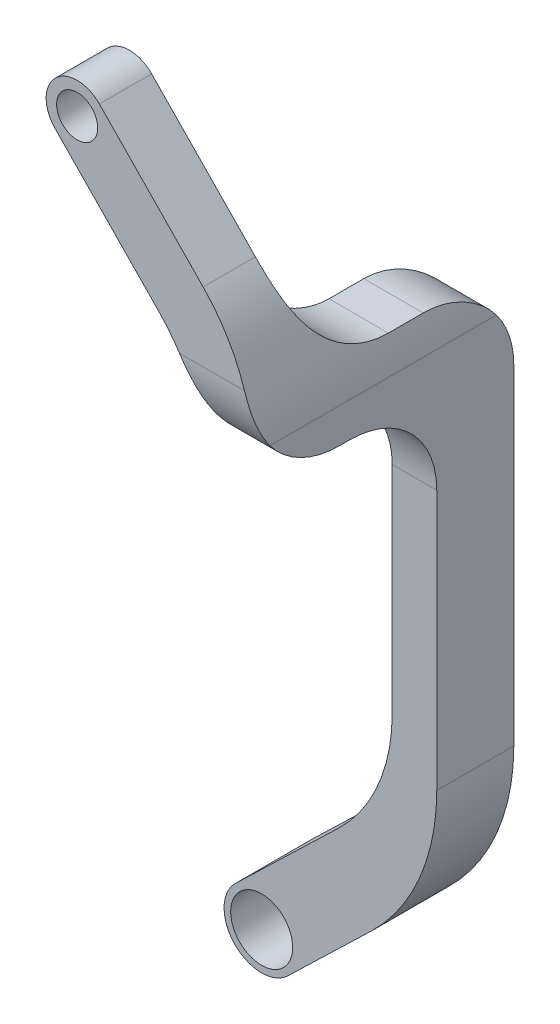
from build123d import *

# Parameters (mm, degrees)
SKETCH_1_R               = 11.8
SKETCH_1_R_2             = 17.8
EXTRUDE_2_DEPTH          = 75
CUT_EXTRUDE_1_DEPTH      = 409.99959193
CUT_EXTRUDE_1_DEPTH_BACK = 409.99959193
SKETCH_2_W               = 349.9
SKETCH_2_H               = 931.6
SKETCH_2_W_2             = 272.2
SKETCH_2_H_2             = 1939.2
FILLET_1_R               = 50


with BuildPart() as part:
    # 草图1 → 凸台-拉伸2 (new, symmetric)
    with BuildSketch(Plane.XY):
        with BuildLine():
            Line((-35.522730508, 95.251379062), (24.047591424, 34.058759041))
            ThreePointArc((24.047591424, 34.058759041), (45.036365139, 1.951247863), (52.39346962, -35.695716288))
            Line((52.39346962, -35.695716288), (52.39346962, -254.995716288))
            ThreePointArc((52.39346962, -254.995716288), (42.566387073, -303.252504348), (14.650341024, -343.823226775))
            Line((14.650341024, -343.823226775), (-33.168257533, -389.93401824))
            ThreePointArc((-33.168257533, -389.93401824), (-63.662585593, -389.379575912), (-63.108143264, -358.885247852))
            Line((-63.108143264, -358.885247852), (-3.792973322, -301.688476836))
            ThreePointArc((-3.792973322, -301.688476836), (18.829755143, -268.810595941), (26.79346962, -229.704047294))
            Line((26.79346962, -229.704047294), (26.79346962, -60.304047294))
            ThreePointArc((26.79346962, -60.304047294), (19.460018396, -22.778118982), (-1.461275938, 9.226165824))
            Line((-1.461275938, 9.226165824), (-61.03159787, 70.418785844))
            ThreePointArc((-61.03159787, 70.418785844), (-60.693460797, 95.589516134), (-35.522730508, 95.251379062))
        make_face()
        with Locations((-48.277164189, 82.835082453)):
            Circle(SKETCH_1_R, mode=Mode.SUBTRACT)
        with Locations((-48.138200399, -374.409633046)):
            Circle(SKETCH_1_R_2, mode=Mode.SUBTRACT)
    extrude(amount=EXTRUDE_2_DEPTH, both=True)

    # 草图2 → 切除-拉伸1 (cut, two sides: drawn at the far end of the back side and taken through both)
    with BuildSketch(Plane(origin=(0, 0, 0), x_dir=(0, 0, -1), z_dir=(1, 0, 0)).offset(-CUT_EXTRUDE_1_DEPTH_BACK)):
        with Locations((129.95, 450.104283712)):
            Rectangle(SKETCH_2_W, SKETCH_2_H)
        with Locations((-105.32326979, -1025.295716288)):
            Rectangle(SKETCH_2_W_2, SKETCH_2_H_2)
    extrude(amount=CUT_EXTRUDE_1_DEPTH + CUT_EXTRUDE_1_DEPTH_BACK, mode=Mode.SUBTRACT)

    # 圆角1
    fillet_1_edges = [part.edges().sort_by_distance(p)[0] for p in [
        (33.313903749, -15.695716288, 45),
        (39.5401781, -55.695716288, -30.77673021),
    ]]
    fillet(fillet_1_edges, radius=FILLET_1_R)
    fillet_1_2_edges = [part.edges().sort_by_distance(p)[0] for p in [
        (39.5401781, -55.695716288, 75),
        (33.313903749, -15.695716288, -75),
    ]]
    fillet(fillet_1_2_edges, radius=FILLET_1_R)


solid = part.part
